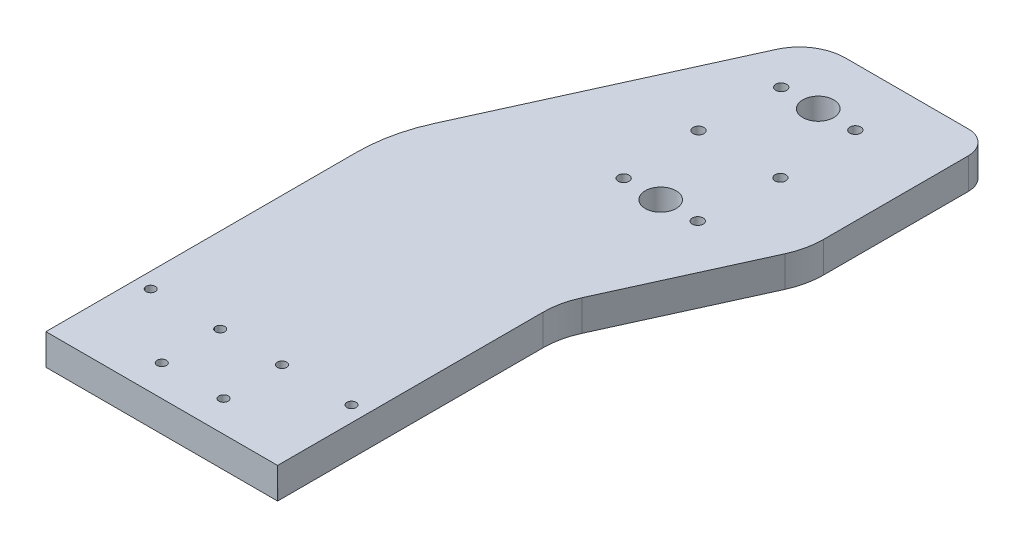
from build123d import *
from build123d.topology import SkipClean

# Parameters (mm, degrees)
BOSS_EXTRUDE1_DEPTH  = 20
FILLET1_R            = 15
FILLET3_R            = 30
FILLET4_R            = 100
CUT_EXTRUDE1_DEPTH   = 20
FILLET6_R            = 50
FILLET7_R            = 50
FILLET9_R            = 0.1
FILLET10_R           = 0.1
SKETCH3_R            = 3
CUT_EXTRUDE2_DEPTH   = 13
SKETCH4_R            = 8
SKETCH4_R_2          = 10
CUT_EXTRUDE3_DEPTH   = 30
SKETCH5_R            = 3.5
CUT_EXTRUDE4_DEPTH   = 13
SKETCH6_R            = 3.5
CUT_EXTRUDE5_DEPTH   = 13
SKETCH7_R            = 3
BOSS_EXTRUDE2_DEPTH  = 13
SKETCH8_R            = 3
BOSS_EXTRUDE3_DEPTH  = 13
SKETCH9_R            = 8
SKETCH9_R_2          = 3.5
SKETCH9_R_3          = 10
CUT_EXTRUDE6_DEPTH   = 13
SKETCH10_R           = 3.5
BOSS_EXTRUDE4_DEPTH  = 13
SKETCH12_W           = 149.9
SKETCH12_H           = 13
CUT_EXTRUDE9_DEPTH   = 70
SKETCH13_R           = 3
CUT_EXTRUDE12_DEPTH  = 60
SKETCH16_R           = 8
SKETCH16_R_2         = 3.5
SKETCH16_R_3         = 10
CUT_EXTRUDE14_DEPTH  = 60
BOSS_EXTRUDE5_START  = -7
BOSS_EXTRUDE5_DEPTH  = 7
SKETCH18_W           = 85.102461965
SKETCH18_H           = 20
BOSS_EXTRUDE6_DEPTH  = 2.25
BOSS_EXTRUDE7_DEPTH  = 20
FILLET11_R           = 30
FILLET12_R           = 15
BOSS_EXTRUDE9_START  = -20
BOSS_EXTRUDE9_DEPTH  = 20
FILLET13_R           = 30
FILLET14_R           = 15
SKETCH21_R           = 8
BOSS_EXTRUDE10_DEPTH = 20


with BuildPart() as part:
    # Sketch1 → Boss-Extrude1 (new body)
    with BuildSketch(Plane(origin=(0, 0, 0), x_dir=(1, 0, 0), z_dir=(0, 1, 0))):
        Polygon((0, 0), (150, 0), (150, 150), (200, 260), (200, 400), (80.578675248, 400), (0, 222.694428273), align=None)
    extrude(amount=BOSS_EXTRUDE1_DEPTH)

    # Fillet1
    fillet1_edges = [part.edges().sort_by_distance(p)[0] for p in [
        (200, 10, -400),
    ]]
    fillet(fillet1_edges, radius=FILLET1_R)

    # Fillet3
    fillet3_edges = [part.edges().sort_by_distance(p)[0] for p in [
        (80.578675248, 10, -400),
    ]]
    fillet(fillet3_edges, radius=FILLET3_R)

    # Fillet4
    fillet4_edges = [part.edges().sort_by_distance(p)[0] for p in [
        (0, 10, -222.694428273),
    ]]
    fillet(fillet4_edges, radius=FILLET4_R)

    # Sketch2 → Cut-Extrude1 (cut)
    with BuildSketch(Plane(origin=(0, 20, 0), x_dir=(1, 0, 0), z_dir=(0, 1, 0))):
        Polygon((150, 150), (150, 173.876585238), (150, 182.670606049), (200, 292.6907641), (200, 260), align=None)
    extrude(amount=-CUT_EXTRUDE1_DEPTH, mode=Mode.SUBTRACT)

    # Fillet6
    fillet6_edges = [part.edges().sort_by_distance(p)[0] for p in [
        (200, 10, -292.6907641),
    ]]
    fillet(fillet6_edges, radius=FILLET6_R)

    # Fillet7
    fillet7_edges = [part.edges().sort_by_distance(p)[0] for p in [
        (150, 10, -182.670606049),
    ]]
    fillet(fillet7_edges, radius=FILLET7_R)

    # Fillet9
    fillet9_edges = [part.edges().sort_by_distance(p)[0] for p in [
        (0, 10, 0),
    ]]
    fillet(fillet9_edges, radius=FILLET9_R)

    # Fillet10
    fillet10_edges = [part.edges().sort_by_distance(p)[0] for p in [
        (150, 10, 0),
    ]]
    fillet(fillet10_edges, radius=FILLET10_R)

    # Sketch3 → Cut-Extrude2 (cut)
    with BuildSketch(Plane(origin=(0, 20, 0), x_dir=(1, 0, 0), z_dir=(0, 1, 0))):
        with Locations(Location((10, 57.83, 0), (0, 0, 270))):
            Circle(SKETCH3_R)
        with Locations(Location((55, 57.83, 0), (0, 0, 270))):
            Circle(SKETCH3_R)
        with Locations(Location((55, 20, 0), (0, 0, 270))):
            Circle(SKETCH3_R)
        with Locations(Location((95, 57.83, 0), (0, 0, 270))):
            Circle(SKETCH3_R)
        with Locations(Location((140, 57.83, 0), (0, 0, 270))):
            Circle(SKETCH3_R)
        with Locations(Location((95, 20, 0), (0, 0, 270))):
            Circle(SKETCH3_R)
    extrude(amount=-CUT_EXTRUDE2_DEPTH, mode=Mode.SUBTRACT)

    # Sketch4 → Cut-Extrude3 (cut)
    with BuildSketch(Plane(origin=(0, 20, 0), x_dir=(1, 0, 0), z_dir=(0, 1, 0))):
        with Locations(Location((125, 330, 0), (0, 0, 270))):
            Circle(SKETCH4_R)
        with Locations(Location((125, 375, 0), (0, 0, 270))):
            Circle(SKETCH4_R_2)
        with Locations(Location((125, 285, 0), (0, 0, 270))):
            Circle(SKETCH4_R_2)
    extrude(amount=-CUT_EXTRUDE3_DEPTH, mode=Mode.SUBTRACT)

    # Sketch5 → Cut-Extrude4 (cut)
    with BuildSketch(Plane(origin=(0, 20, 0), x_dir=(1, 0, 0), z_dir=(0, 1, 0))):
        with Locations(Location((149, 375, 0), (0, 0, 270))):
            Circle(SKETCH5_R)
        with Locations(Location((101, 375, 0), (0, 0, 270))):
            Circle(SKETCH5_R)
        with Locations(Location((149, 285, 0), (0, 0, 270))):
            Circle(SKETCH5_R)
        with Locations(Location((101, 285, 0), (0, 0, 270))):
            Circle(SKETCH5_R)
    extrude(amount=-CUT_EXTRUDE4_DEPTH, mode=Mode.SUBTRACT)

    # Sketch6 → Cut-Extrude5 (cut)
    with BuildSketch(Plane(origin=(0, 20, 0), x_dir=(1, 0, 0), z_dir=(0, 1, 0))):
        with Locations(Location((151.5, 330, 0), (0, 0, 270))):
            Circle(SKETCH6_R)
        with Locations(Location((98.5, 330, 0), (0, 0, 270))):
            Circle(SKETCH6_R)
    extrude(amount=-CUT_EXTRUDE5_DEPTH, mode=Mode.SUBTRACT)

    # Sketch7 → Boss-Extrude2 (add)
    with BuildSketch(Plane(origin=(0, 20, 0), x_dir=(1, 0, 0), z_dir=(0, 1, 0))):
        with BuildLine():
            Line((149.9, 0), (0.1, 0))
            Line((0.1, 0), (0.1, -70))
            Line((0.1, -70), (39.581431097, -70))
            Line((39.581431097, -70), (55.1, -70))
            Line((55.1, -70), (150, -70))
            Line((150, -70), (150, 0.1))
            ThreePointArc((150, 0.1), (149.970710678, 0.029289322), (149.9, 0))
        make_face()
        with Locations(Location((10.1, -12.17, 0), (0, 0, 270))):
            Circle(SKETCH7_R, mode=Mode.SUBTRACT)
        with BuildLine():
            ThreePointArc((58.1, -50), (57.221320344, -52.121320344), (55.1, -53))
            ThreePointArc((55.1, -53), (52.1, -50), (55.1, -47))
            ThreePointArc((55.1, -47), (57.221320344, -47.878679656), (58.1, -50))
        make_face(mode=Mode.SUBTRACT)
        with BuildLine():
            ThreePointArc((58.1, -12.17), (57.221320344, -14.291320344), (55.1, -15.17))
            ThreePointArc((55.1, -15.17), (52.978679656, -14.291320344), (52.1, -12.17))
            ThreePointArc((52.1, -12.17), (55.1, -9.17), (58.1, -12.17))
        make_face(mode=Mode.SUBTRACT)
        with BuildLine():
            ThreePointArc((98.1, -50), (92.978679656, -52.121320344), (95.1, -47))
            ThreePointArc((95.1, -47), (97.221320344, -47.878679656), (98.1, -50))
        make_face(mode=Mode.SUBTRACT)
        with BuildLine():
            ThreePointArc((95.1, -15.17), (92.978679656, -14.291320344), (92.1, -12.17))
            ThreePointArc((92.1, -12.17), (95.1, -9.17), (98.1, -12.17))
            ThreePointArc((98.1, -12.17), (97.221320344, -14.291320344), (95.1, -15.17))
        make_face(mode=Mode.SUBTRACT)
        with BuildLine():
            ThreePointArc((143.1, -12.17), (140.1, -15.17), (137.1, -12.17))
            ThreePointArc((137.1, -12.17), (140.1, -9.17), (143.1, -12.17))
        make_face(mode=Mode.SUBTRACT)
    extrude(amount=-BOSS_EXTRUDE2_DEPTH)

    # Sketch8 → Boss-Extrude3 (add)
    with BuildSketch(Plane(origin=(0, 20, 0), x_dir=(1, 0, 0), z_dir=(0, 1, 0))):
        with Locations((10, 57.83)):
            Circle(SKETCH8_R)
        with Locations((55, 57.83)):
            Circle(SKETCH8_R)
        with Locations((95, 57.83)):
            Circle(SKETCH8_R)
        with Locations((140, 57.83)):
            Circle(SKETCH8_R)
        with Locations((95, 20)):
            Circle(SKETCH8_R)
        with Locations((55, 20)):
            Circle(SKETCH8_R)
    extrude(amount=-BOSS_EXTRUDE3_DEPTH)

    # Sketch9 → Cut-Extrude6 (cut)
    with BuildSketch(Plane(origin=(0, 20, 0), x_dir=(1, 0, 0), z_dir=(0, 1, 0))):
        with Locations((125, 324)):
            Circle(SKETCH9_R)
        with Locations((98.5, 324)):
            Circle(SKETCH9_R_2)
        with Locations((151.5, 324)):
            Circle(SKETCH9_R_2)
        with Locations(Location((101, 273, 0), (0, 0, 270))):
            Circle(SKETCH9_R_2)
        with Locations((125, 273)):
            Circle(SKETCH9_R_3)
        with Locations(Location((149, 273, 0), (0, 0, 270))):
            Circle(SKETCH9_R_2)
    extrude(amount=-CUT_EXTRUDE6_DEPTH, mode=Mode.SUBTRACT)

    # Sketch10 → Boss-Extrude4 (add)
    with BuildSketch(Plane(origin=(0, 20, 0), x_dir=(1, 0, 0), z_dir=(0, 1, 0))):
        with BuildLine():
            ThreePointArc((117.583801513, 327), (125, 332), (132.416198487, 327))
            ThreePointArc((132.416198487, 327), (132.85269342, 328.4718619), (133, 330))
            ThreePointArc((133, 330), (123.4718619, 337.85269342), (117.583801513, 327))
        make_face()
        with BuildLine():
            ThreePointArc((149.697224362, 327), (151.5, 327.5), (153.302775638, 327))
            ThreePointArc((153.302775638, 327), (154.546285831, 328.276589824), (155, 330))
            ThreePointArc((155, 330), (149.776589824, 333.046285831), (149.697224362, 327))
        make_face()
        with BuildLine():
            ThreePointArc((100.302775638, 327), (101.546285831, 328.276589824), (102, 330))
            ThreePointArc((102, 330), (96.776589824, 333.046285831), (96.697224362, 327))
            ThreePointArc((96.697224362, 327), (98.5, 327.5), (100.302775638, 327))
        make_face()
        with Locations((101, 285)):
            Circle(SKETCH10_R)
        with BuildLine():
            ThreePointArc((133, 279), (134.486832981, 281.83772234), (135, 285))
            ThreePointArc((135, 285), (121.83772234, 294.486832981), (117, 279))
            ThreePointArc((117, 279), (125, 283), (133, 279))
        make_face()
        with Locations((149, 285)):
            Circle(SKETCH10_R)
    extrude(amount=-BOSS_EXTRUDE4_DEPTH)

    # Sketch12 → Cut-Extrude9 (cut)
    with BuildSketch(Plane.XY.offset(70)):
        with Locations((75.05, 13.5)):
            Rectangle(SKETCH12_W, SKETCH12_H)
    extrude(amount=-CUT_EXTRUDE9_DEPTH, mode=Mode.SUBTRACT)

    # Sketch13 → Cut-Extrude12 (cut)
    with BuildSketch(Plane(origin=(0, 20, 0), x_dir=(1, 0, 0), z_dir=(0, 1, 0))):
        with Locations(Location((9.999499987, 57.83, 0), (0, 0, 270))):
            Circle(SKETCH13_R)
        with Locations(Location((54.999499987, 57.83, 0), (0, 0, 270))):
            Circle(SKETCH13_R)
        with Locations(Location((95, 57.83, 0), (0, 0, 270))):
            Circle(SKETCH13_R)
        with Locations(Location((140, 57.83, 0), (0, 0, 270))):
            Circle(SKETCH13_R)
        with Locations(Location((95, 20, 0), (0, 0, 270))):
            Circle(SKETCH13_R)
        with Locations(Location((54.999499987, 20, 0), (0, 0, 270))):
            Circle(SKETCH13_R)
    extrude(amount=-CUT_EXTRUDE12_DEPTH, mode=Mode.SUBTRACT)

    # Sketch16 → Cut-Extrude14 (cut)
    with BuildSketch(Plane(origin=(0, 20, 0), x_dir=(1, 0, 0), z_dir=(0, 1, 0))):
        with Locations(Location((125, 324, 0), (0, 0, 270))):
            Circle(SKETCH16_R)
        with Locations(Location((151.5, 324, 0), (0, 0, 270))):
            Circle(SKETCH16_R_2)
        with Locations(Location((101, 273, 0), (0, 0, 270))):
            Circle(SKETCH16_R_2)
        with Locations(Location((125, 273, 0), (0, 0, 270))):
            Circle(SKETCH16_R_3)
        with Locations(Location((149, 273, 0), (0, 0, 270))):
            Circle(SKETCH16_R_2)
        with Locations(Location((98.5, 324, 0), (0, 0, 270))):
            Circle(SKETCH16_R_2)
        with Locations(Location((101, 375, 0), (0, 0, 270))):
            Circle(SKETCH16_R_2)
        with Locations(Location((149, 375, 0), (0, 0, 270))):
            Circle(SKETCH16_R_2)
    extrude(amount=-CUT_EXTRUDE14_DEPTH, mode=Mode.SUBTRACT)

    # Sketch17 → Boss-Extrude5 (add)
    with SkipClean():  # the faces are left unmerged after this step: merging them gives an invalid solid
        with BuildSketch(Plane.XZ.offset(BOSS_EXTRUDE5_START)):
            with BuildLine():
                ThreePointArc((133, -279), (125, -283), (117, -279))
                ThreePointArc((117, -279), (121.83772234, -294.486832981), (135, -285))
                ThreePointArc((135, -285), (134.486832981, -281.83772234), (133, -279))
            make_face()
            with BuildLine():
                ThreePointArc((132.416198487, -327), (125, -332), (117.583801513, -327))
                ThreePointArc((117.583801513, -327), (123.4718619, -337.85269342), (133, -330))
                ThreePointArc((133, -330), (132.85269342, -328.4718619), (132.416198487, -327))
            make_face()
        extrude(amount=BOSS_EXTRUDE5_DEPTH)
    add(part.part.scale(1), mode=Mode.REPLACE)  # the faces are merged on a copy

    # Sketch18 → Boss-Extrude6 (add)
    with BuildSketch(Plane(origin=(0, 0, -400), x_dir=(-1, 0, 0), z_dir=(0, 0, -1))):
        with Locations((-142.448769018, 10)):
            Rectangle(SKETCH18_W, SKETCH18_H)
    extrude(amount=BOSS_EXTRUDE6_DEPTH)

    # Sketch19 → Boss-Extrude7 (add)
    with BuildSketch(Plane(origin=(0, 20, 0), x_dir=(1, 0, 0), z_dir=(0, 1, 0))):
        with BuildLine():
            Line((83.357981151, 402.25), (74.614259042, 386.147934958))
            ThreePointArc((74.614259042, 386.147934958), (85.482928236, 396.310055575), (99.897538035, 400))
            Line((99.897538035, 400), (99.897538035, 402.25))
            Line((99.897538035, 402.25), (83.357981151, 402.25))
        make_face()
        with BuildLine():
            Line((200, 385), (200, 402.25))
            Line((200, 402.25), (185, 402.25))
            Line((185, 402.25), (185, 400))
            ThreePointArc((185, 400), (195.606601718, 395.606601718), (200, 385))
        make_face()
    extrude(amount=-BOSS_EXTRUDE7_DEPTH)

    # Fillet11
    fillet11_edges = [part.edges().sort_by_distance(p)[0] for p in [
        (83.357981151, 10, -402.25),
    ]]
    fillet(fillet11_edges, radius=FILLET11_R)

    # Fillet12
    fillet12_edges = [part.edges().sort_by_distance(p)[0] for p in [
        (200, 10, -402.25),
    ]]
    fillet(fillet12_edges, radius=FILLET12_R)

    # Sketch20 → Boss-Extrude9 (add)
    with BuildSketch(Plane(origin=(0, 20, 0), x_dir=(1, 0, 0), z_dir=(0, 1, 0)).offset(BOSS_EXTRUDE9_START)):
        with BuildLine():
            ThreePointArc((74.841300691, 386.566045157), (85.866952215, 398.032565376), (101.205117772, 402.25))
            Line((101.205117772, 402.25), (81.601215135, 402.25))
            Line((81.601215135, 402.25), (72.585686906, 382.412203187))
            ThreePointArc((72.585686906, 382.412203187), (73.533720954, 384.316045157), (74.614259042, 386.147934958))
            Line((74.614259042, 386.147934958), (74.841300691, 386.566045157))
        make_face()
        Polygon((103.016755999, 402.25), (129.316768109, 402.25), (129.316768109, 412.25), (86.145836856, 412.25), (81.601215135, 402.25), (101.205117772, 402.25), align=None)
        Polygon((185, 402.25), (200, 402.25), (200, 412.25), (129.316768109, 412.25), (129.316768109, 402.25), align=None)
        with BuildLine():
            Line((200, 387.25), (200, 402.25))
            Line((200, 402.25), (185, 402.25))
            ThreePointArc((185, 402.25), (195.606601718, 397.856601718), (200, 387.25))
        make_face()
    extrude(amount=BOSS_EXTRUDE9_DEPTH)

    # Fillet13
    fillet13_edges = [part.edges().sort_by_distance(p)[0] for p in [
        (86.145836856, 10, -412.25),
    ]]
    fillet(fillet13_edges, radius=FILLET13_R)

    # Fillet14
    fillet14_edges = [part.edges().sort_by_distance(p)[0] for p in [
        (200, 10, -412.25),
    ]]
    fillet(fillet14_edges, radius=FILLET14_R)

    # Sketch21 → Boss-Extrude10 (add, through all)
    with BuildSketch(Plane(origin=(0, 20, 0), x_dir=(1, 0, 0), z_dir=(0, 1, 0))):
        with Locations((125, 324)):
            Circle(SKETCH21_R)
    extrude(amount=-BOSS_EXTRUDE10_DEPTH)


solid = part.part
